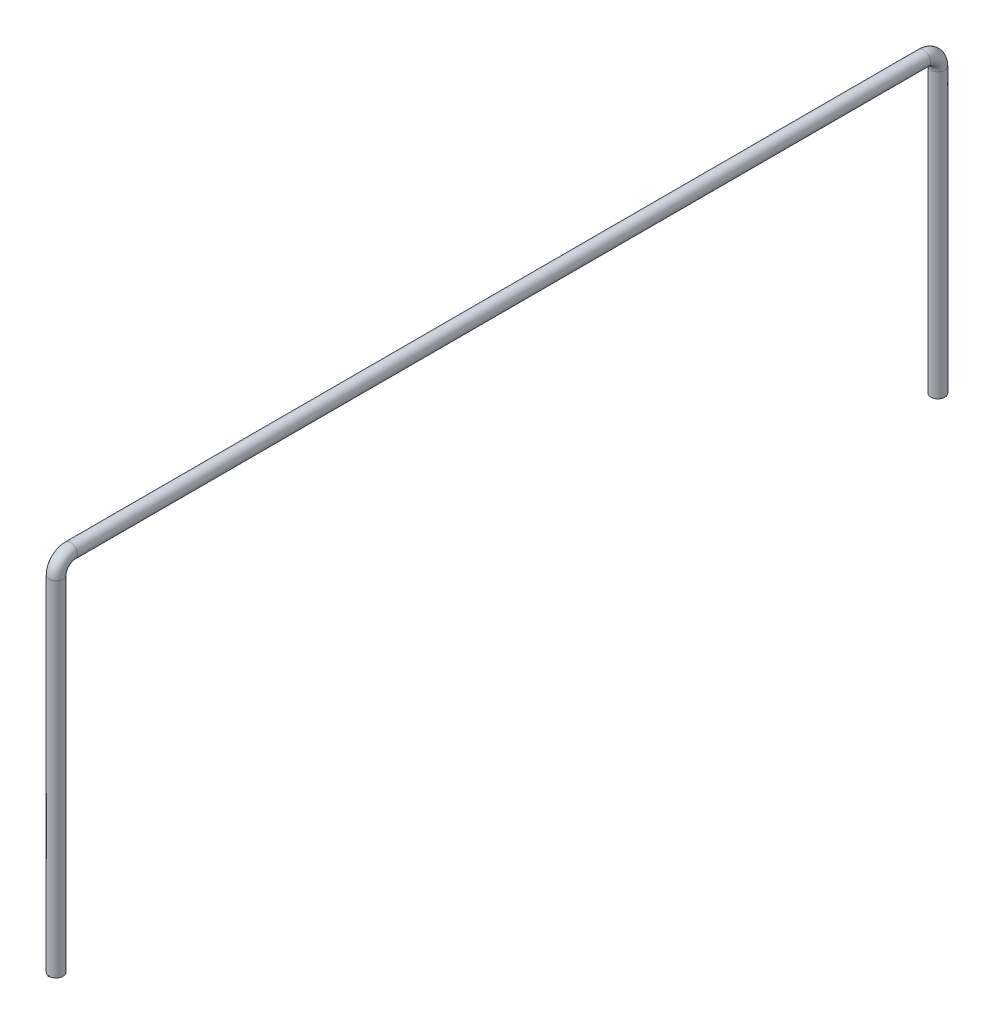
from build123d import *

# Parameters (mm, degrees)
CROQUIS1_R              = 12.7
SALIENTE_EXTRUIR1_DEPTH = 400
CROQUIS2_R              = 12.7
CROQUIS3_W              = 1.865742408
CROQUIS3_H              = 1.528957632
SALIENTE_EXTRUIR2_DEPTH = 1


with BuildPart() as part:
    # Croquis1 → Saliente-Extruir1 (new body)
    with BuildSketch(Plane(origin=(0, 0, 0), x_dir=(1, 0, 0), z_dir=(0, 1, 0))):
        Circle(CROQUIS1_R)
    extrude(amount=SALIENTE_EXTRUIR1_DEPTH)

    # Barrer1: sweep along a curve in space
    with BuildLine() as barrer1_path:
        Line((0, 400, 0), (0, 624, 0))
        ThreePointArc((0, 624, 0), (0, 642.384776311, -7.615223689), (0, 650, -26))
        Line((0, 650, -26), (0, 650, -1574))
        ThreePointArc((0, 650, -1574), (0, 642.384776311, -1592.384776311), (0, 624, -1600))
        Line((0, 624, -1600), (0, 110, -1600))
    # Croquis2 → Barrer1 (sweep)
    with BuildSketch(Plane(origin=(0, 400, 0), x_dir=(1, 0, 0), z_dir=(0, 1, 0))):
        Circle(CROQUIS2_R)
    sweep(path=barrer1_path.line)

    # Croquis3 → Saliente-Extruir2 (add)
    with BuildSketch(Plane.XZ):
        with Locations((0, 12.7)):
            Rectangle(CROQUIS3_W, CROQUIS3_H)
    extrude(amount=-SALIENTE_EXTRUIR2_DEPTH)


solid = part.part
